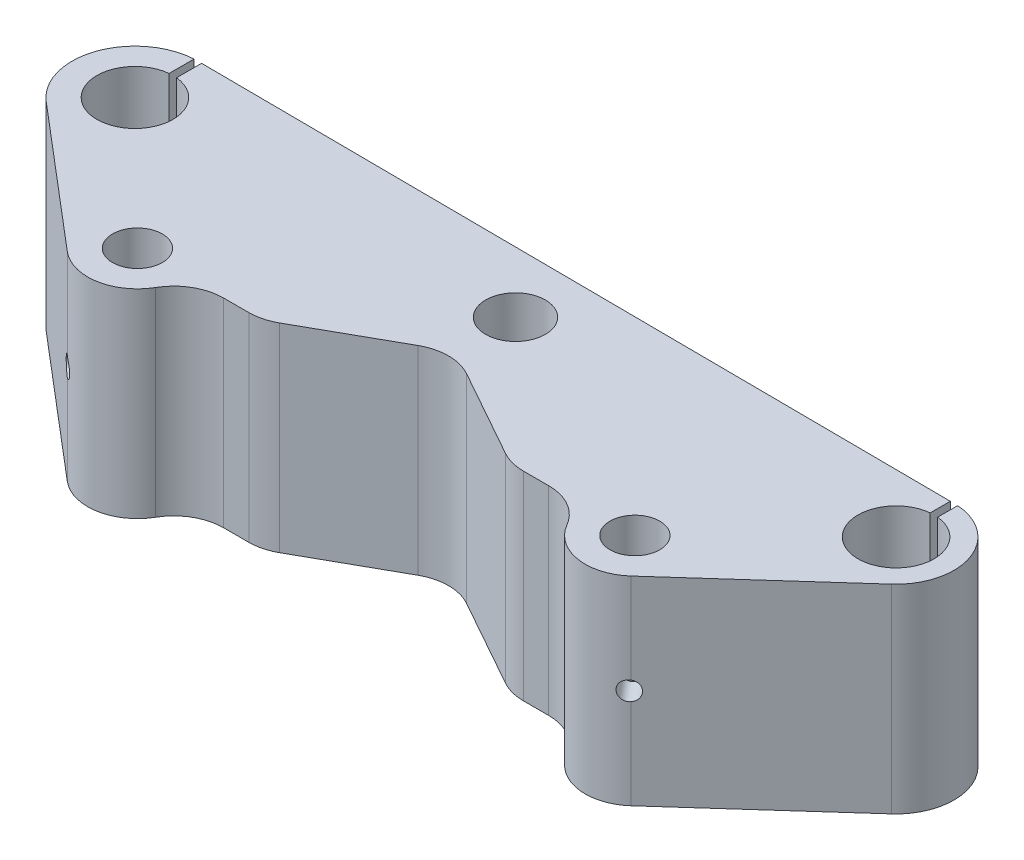
from build123d import *

# Parameters (mm, degrees)
SZKIC1_R                    = 7.65
SZKIC1_R_2                  = 6
SZKIC1_R_3                  = 5
DODANIE_WYCI_GNI_CIE1_DEPTH = 40
SZKIC2_R                    = 11
WYTNIJ_WYCI_GNI_CIE1_DEPTH  = 5
SZKIC3_R                    = 1.25
WYTNIJ_WYCI_GNI_CIE2_DEPTH  = 10
WYTNIJ_WYCI_GNI_CIE3_DEPTH  = 105.133195956
ZAOKR_GLENIE1_R             = 10
SZKIC5_R                    = 1.9
WYTNIJ_WYCI_GNI_CIE4_DEPTH  = 20
WYTNIJ_WYCI_GNI_CIE5_DEPTH  = 105.133196029


with BuildPart() as part:
    # Szkic1 → Dodanie-wyciągnięcie1 (new body)
    with BuildSketch(Plane(origin=(0, 0, 0), x_dir=(1, 0, 0), z_dir=(0, 1, 0))):
        with BuildLine():
            ThreePointArc((-76.5, 12.65), (-88.373421198, 4.363985457), (-84.69216402, -9.639032559))
            Line((-84.69216402, -9.639032559), (-56.476018988, -33.619788584))
            ThreePointArc((-56.476018988, -33.619788584), (-45.802392937, -35.076348106), (-40, -26))
            Line((-40, -26), (40, -26))
            ThreePointArc((40, -26), (45.925221554, -35.13215093), (56.679236123, -33.442298356))
            Line((56.679236123, -33.442298356), (84.281310083, -8.670277585))
            ThreePointArc((84.281310083, -8.670277585), (87.39314959, 4.130592211), (76.576123228, 11.649751296))
            Line((76.576123228, 11.649751296), (-76.5, 12.65))
        make_face()
        with Locations((-76.5, 0)):
            Circle(SZKIC1_R, mode=Mode.SUBTRACT)
        Circle(SZKIC1_R_2, mode=Mode.SUBTRACT)
        with Locations((76.5, 0)):
            Circle(SZKIC1_R, mode=Mode.SUBTRACT)
        with Locations((50, -26)):
            Circle(SZKIC1_R_3, mode=Mode.SUBTRACT)
        with Locations((-50, -26)):
            Circle(SZKIC1_R_3, mode=Mode.SUBTRACT)
    extrude(amount=DODANIE_WYCI_GNI_CIE1_DEPTH)

    # Szkic2 → Wytnij-wyciągnięcie1 (cut)
    with BuildSketch(Plane.XZ):
        Circle(SZKIC2_R)
    extrude(amount=-WYTNIJ_WYCI_GNI_CIE1_DEPTH, mode=Mode.SUBTRACT)

    # Szkic3 → Wytnij-wyciągnięcie2 (cut)
    with BuildSketch(Plane.XZ.offset(-5)):
        with Locations((-5.656854249, 5.656854249)):
            Circle(SZKIC3_R)
        with Locations((5.656854249, 5.656854249)):
            Circle(SZKIC3_R)
        with Locations((5.656854249, -5.656854249)):
            Circle(SZKIC3_R)
        with Locations((-5.656854249, -5.656854249)):
            Circle(SZKIC3_R)
    extrude(amount=-WYTNIJ_WYCI_GNI_CIE2_DEPTH, mode=Mode.SUBTRACT)

    # Szkic4 → Wytnij-wyciągnięcie3 (cut, through all)
    with BuildSketch(Plane(origin=(0, 40, 0), x_dir=(1, 0, 0), z_dir=(0, 1, 0))):
        Polygon((-25, -26), (0, -12), (25, -26), align=None)
    extrude(amount=-WYTNIJ_WYCI_GNI_CIE3_DEPTH, mode=Mode.SUBTRACT)

    # Zaokrąglenie1
    zaokr_glenie1_edges = [part.edges().sort_by_distance(p)[0] for p in [
        (40, 20, 26),
        (-40, 20, 26),
        (25, 20, 26),
        (0, 20, 12),
        (-25, 20, 26),
    ]]
    fillet(zaokr_glenie1_edges, radius=ZAOKR_GLENIE1_R)

    # Szkic5 → Wytnij-wyciągnięcie4 (cut)
    with BuildSketch(Plane(origin=(-40.2753628, 0, 47.388642659), x_dir=(0.761978858404398, 0, 0.647601898811863), z_dir=(-0.6476018988118629, 0, 0.7619788584043979))):
        with Locations((-21.261293551, 20)):
            Circle(SZKIC5_R)
    wytnij_wyci_gni_cie4 = extrude(amount=-WYTNIJ_WYCI_GNI_CIE4_DEPTH, mode=Mode.SUBTRACT)

    # Lustro1: Wytnij-wyciągnięcie4 across plane
    add(wytnij_wyci_gni_cie4.mirror(Plane(origin=(0, 0, 0), x_dir=(0, 0, 1), z_dir=(1, 0, 0))), mode=Mode.SUBTRACT)

    # Szkic6 → Wytnij-wyciągnięcie5 (cut, through all)
    with BuildSketch(Plane(origin=(0, 40, 0), x_dir=(1, 0, 0), z_dir=(0, 1, 0))):
        with BuildLine():
            ThreePointArc((-77.25, 7.613146524), (-76.5, 7.65), (-75.75, 7.613146524))
            Line((-75.75, 7.613146524), (-75.75, 12.645099258))
            Line((-75.75, 12.645099258), (-76.5, 12.65))
            ThreePointArc((-76.5, 12.65), (-76.875165026, 12.644435583), (-77.25, 12.627747226))
            Line((-77.25, 12.627747226), (-77.25, 7.613146524))
        make_face()
        with BuildLine():
            Line((76.576123228, 11.649751296), (75.75, 11.655149451))
            Line((75.75, 11.655149451), (75.75, 7.613146524))
            ThreePointArc((75.75, 7.613146524), (76.5, 7.65), (77.25, 7.613146524))
            Line((77.25, 7.613146524), (77.25, 11.625833303))
            ThreePointArc((77.25, 11.625833303), (76.913234697, 11.642668813), (76.576123228, 11.649751296))
        make_face()
    extrude(amount=-WYTNIJ_WYCI_GNI_CIE5_DEPTH, mode=Mode.SUBTRACT)


solid = part.part
